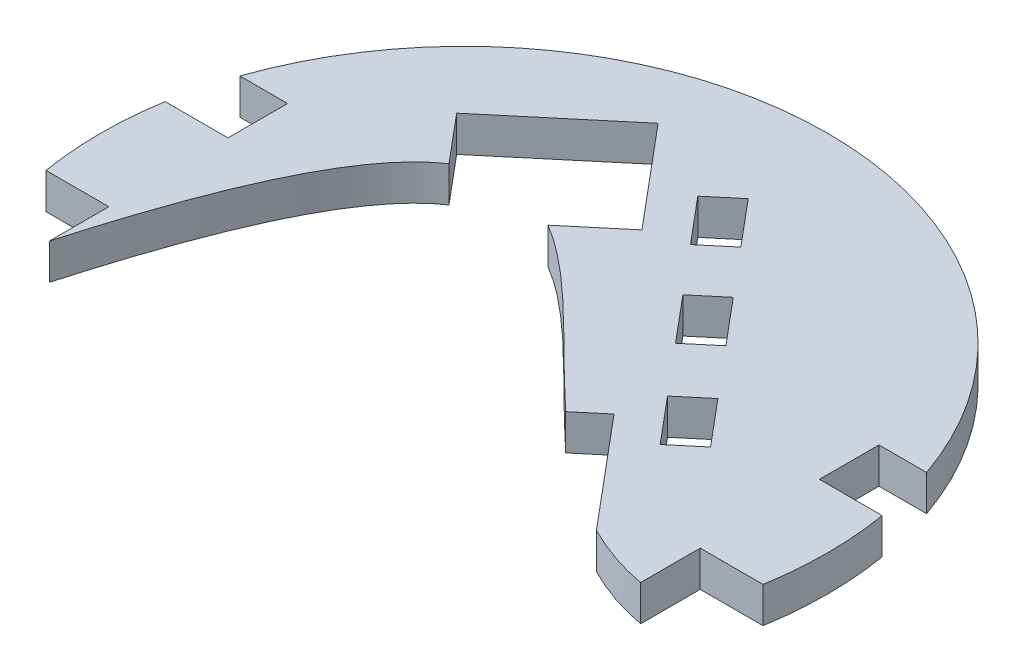
from build123d import *

# Parameters (mm, degrees)
CROQUIS1_R              = 30.5
SALIENTE_EXTRUIR1_DEPTH = 3
CROQUIS2_R              = 2
CORTAR_EXTRUIR1_DEPTH   = 4
CORTAR_EXTRUIR3_START   = -4
CORTAR_EXTRUIR3_DEPTH   = 4
CORTAR_EXTRUIR5_START   = -4
CROQUIS7_R              = 2
CORTAR_EXTRUIR5_DEPTH   = 4
CORTAR_EXTRUIR6_DEPTH   = 10


with BuildPart() as part:
    # Croquis1 → Saliente-Extruir1 (new body)
    with BuildSketch(Plane(origin=(0, 0, 0), x_dir=(1, 0, 0), z_dir=(0, 1, 0))):
        Circle(CROQUIS1_R)
    extrude(amount=SALIENTE_EXTRUIR1_DEPTH)

    # Croquis2 → Cortar-Extruir1 (cut)
    with BuildSketch(Plane(origin=(0, 3, 0), x_dir=(1, 0, 0), z_dir=(0, 1, 0))):
        Circle(CROQUIS2_R)
    extrude(amount=-CORTAR_EXTRUIR1_DEPTH, mode=Mode.SUBTRACT)

    # Croquis5 → Cortar-Extruir3 (cut)
    with BuildSketch(Plane(origin=(0, 3, 0), x_dir=(1, 0, 0), z_dir=(0, 1, 0)).offset(CORTAR_EXTRUIR3_START)):
        with BuildLine():
            Line((30.087372767, -5), (24.814059068, -5))
            Line((24.814059068, -5), (24.814059068, -10))
            Line((24.814059068, -10), (28.814059068, -10))
            ThreePointArc((28.814059068, -10), (29.556634924, -7.526973624), (30.087372767, -5))
        make_face()
        with BuildLine():
            Line((24.814059068, 5), (30.087372767, 5))
            ThreePointArc((30.087372767, 5), (29.556634924, 7.526973624), (28.814059068, 10))
            Line((28.814059068, 10), (24.814059068, 10))
            Line((24.814059068, 10), (24.814059068, 5))
        make_face()
        with BuildLine():
            ThreePointArc((-30.087372767, -5), (-29.556634924, -7.526973624), (-28.814059068, -10))
            Line((-28.814059068, -10), (-24.814059068, -10))
            Line((-24.814059068, -10), (-24.814059068, -5))
            Line((-24.814059068, -5), (-30.087372767, -5))
        make_face()
        with BuildLine():
            Line((-24.814059068, 10), (-28.814059068, 10))
            ThreePointArc((-28.814059068, 10), (-29.556634924, 7.526973624), (-30.087372767, 5))
            Line((-30.087372767, 5), (-24.814059068, 5))
            Line((-24.814059068, 5), (-24.814059068, 10))
        make_face()
    extrude(amount=CORTAR_EXTRUIR3_DEPTH, mode=Mode.SUBTRACT)

    # Croquis7 → Cortar-Extruir5 (cut)
    # profile 1 of 3: a face of its own
    with BuildSketch(Plane(origin=(0, 3, 0), x_dir=(1, 0, 0), z_dir=(0, 1, 0)).offset(CORTAR_EXTRUIR5_START)):
        Polygon((1.428390211, 22.411430151), (-0.869743118, 20.483067322), (2.34419493, 16.652845106), (4.642328259, 18.581207935), align=None)
    # profile 2 of 3: a face of its own
    with BuildSketch(Plane(origin=(0, 3, 0), x_dir=(1, 0, 0), z_dir=(0, 1, 0)).offset(CORTAR_EXTRUIR5_START)):
        with BuildLine():
            add(Edge.make_bspline(
                [(-13.66601447, 12.397212273), (-17.403465693, 9.897923685), (-21.056529869, 3.255841362), (-24.814059068, -10)],
                knots=[0.740637404, 0.740637404, 0.740637404, 0.740637404, 1, 1, 1, 1], degree=3))
            Line((-24.814059068, -10), (-28.814059068, -10))
            ThreePointArc((-28.814059068, -10), (0, -30.5), (28.814059068, -10))
            Line((28.814059068, -10), (24.814059068, -10))
            add(Edge.make_bspline(
                [(24.814059068, -10), (22.863263717, -9.657344338), (20.984021298, -8.980450277), (19.168992989, -8.065339906)],
                knots=[0, 0, 0, 0, 0.087850084, 0.087850084, 0.087850084, 0.087850084], degree=3))
            Line((19.168992989, -8.065339906), (11.455541673, 1.127193412))
            Line((11.455541673, 1.127193412), (9.248678515, -0.72458465))
            add(Edge.make_bspline(
                [(9.248678515, -0.72458465), (4.033234859, 4.116641048), (-0.646914404, 9.508508747), (-5.04935939, 12.080675515)],
                knots=[0.258799312, 0.258799312, 0.258799312, 0.258799312, 0.546435258, 0.546435258, 0.546435258, 0.546435258], degree=3))
            Line((-5.04935939, 12.080675515), (-0.757422911, 15.682037831))
            Line((-0.757422911, 15.682037831), (-7.828086618, 24.108526705))
            Line((-7.828086618, 24.108526705), (-17.020619935, 16.395075389))
            Line((-17.020619935, 16.395075389), (-13.66601447, 12.397212273))
        make_face()
        Circle(CROQUIS7_R, mode=Mode.SUBTRACT)
    # profile 3 of 3: a face of its own
    with BuildSketch(Plane(origin=(0, 3, 0), x_dir=(1, 0, 0), z_dir=(0, 1, 0)).offset(CORTAR_EXTRUIR5_START)):
        Polygon((14.685884661, 6.611763511), (12.387751331, 4.683400682), (15.60168938, 0.853178467), (17.899822709, 2.781541296), align=None)
    extrude(amount=CORTAR_EXTRUIR5_DEPTH, mode=Mode.SUBTRACT)

    # Croquis9 → Cortar-Extruir6 (cut)
    with BuildSketch(Plane(origin=(0, 3, 0), x_dir=(1, 0, 0), z_dir=(0, 1, 0))):
        Polygon((7.971418181, 14.613753061), (5.673284852, 12.685390231), (8.887222901, 8.855168016), (11.18535623, 10.783530845), align=None)
    extrude(amount=-CORTAR_EXTRUIR6_DEPTH, mode=Mode.SUBTRACT)


solid = part.part
